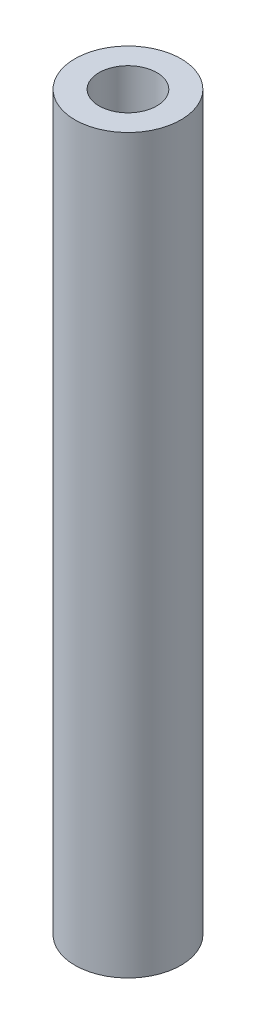
from build123d import *

# Parameters (mm, degrees)
SKETCH1_R           = 2.75
SKETCH1_R_2         = 1.5
BOSS_EXTRUDE1_DEPTH = 38


with BuildPart() as part:
    # Sketch1 → Boss-Extrude1 (new body)
    with BuildSketch(Plane(origin=(0, 0, 0), x_dir=(1, 0, 0), z_dir=(0, 1, 0))):
        Circle(SKETCH1_R)
        Circle(SKETCH1_R_2, mode=Mode.SUBTRACT)
    extrude(amount=BOSS_EXTRUDE1_DEPTH)


solid = part.part
